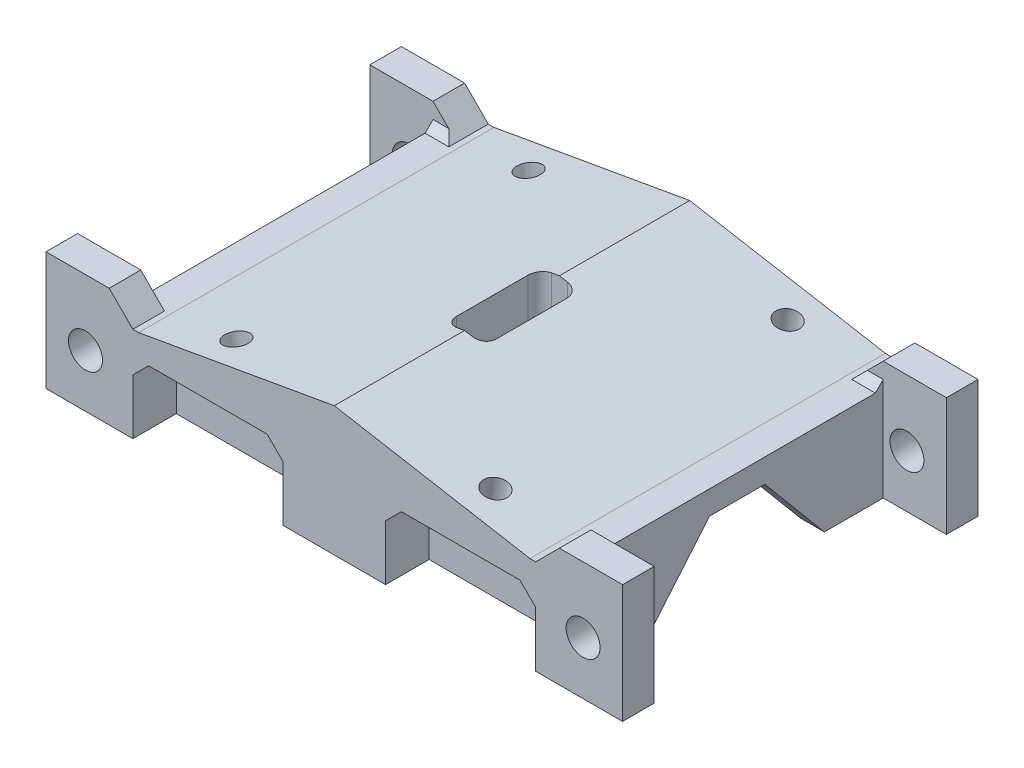
from build123d import *

# Parameters (mm, degrees)
SKETCH_1_W                 = 57
SKETCH_1_H                 = 45
EXTRUDE_1_DEPTH            = 3
SKETCH_2_W                 = 4
SKETCH_2_H                 = 15
EXTRUDE_2_DEPTH            = 8
SKETCH_3_W                 = 4
SKETCH_3_H                 = 15
EXTRUDE_3_DEPTH            = 8
EXTRUDE_4_DEPTH            = 3
EXTRUDE_5_DEPTH            = 3
CHAMFER_1_SIZE             = 3
SKETCH_6_R                 = 2.15
CUT_EXTRUDE_1_DEPTH        = 4
SKETCH_8_W                 = 8
SKETCH_8_H                 = 3
EXTRUDE_6_DEPTH            = 9
EXTRUDE_7_DEPTH            = 3
SKETCH_12_W                = 5
SKETCH_12_H                = 12
CUT_EXTRUDE_4_DEPTH        = 3
FILLET_1_R                 = 1.5
EXTRUDE_9_REACH            = 82.13
SKETCH_15_W                = 45
SKETCH_15_H                = 17.726539555
SKETCH_16_R                = 1.5
CUT_EXTRUDE_5_DEPTH        = 81.129959324
CHAMFER_1_OF_MIRROR_2_SIZE = 3
CHAMFER_2_SIZE             = 1
CHAMFER_3_SIZE             = 2
DELETE_START               = -45
DELETE_FACE_1_DEPTH        = 45
DELETE_FACE_1_2_DEPTH      = 18
DELETE_START_2             = -18
DELETE_FACE_1_3_DEPTH      = 18
DELETE_START_3             = 3
DELETE_FACE_1_4_DEPTH      = 5
SKETCH_20_W                = 22
SKETCH_20_H                = 4
EXTRUDE_2_2_DEPTH          = 10
MIRROR_4_COPY_1_DEPTH      = 3
SKETCH_21_W                = 4
SKETCH_21_H                = 26
EXTRUDE_3_2_DEPTH          = 10
CHAMFER_4_SIZE             = 2


with BuildPart() as part:
    # 草图1 → 凸台-拉伸1 (new body)
    with BuildSketch(Plane(origin=(0, 0, 0), x_dir=(1, 0, 0), z_dir=(0, 1, 0))):
        with Locations((28.5, 22.5)):
            Rectangle(SKETCH_1_W, SKETCH_1_H)
    extrude(amount=EXTRUDE_1_DEPTH)

    # 草图2 → Extrude 2 (add)
    with BuildSketch(Plane.ZY):
        with Locations((-2, -1.5)):
            Rectangle(SKETCH_2_W, SKETCH_2_H)
    extrude_2 = extrude(amount=EXTRUDE_2_DEPTH)

    # 草图3 → Extrude 3 (add)
    with BuildSketch(Plane(origin=(57, 0, 0), x_dir=(0, 0, -1), z_dir=(1, 0, 0))):
        with Locations((2, -1.5)):
            Rectangle(SKETCH_3_W, SKETCH_3_H)
    extrude_3 = extrude(amount=EXTRUDE_3_DEPTH)

    # 草图4 → 凸台-拉伸4 (add)
    with BuildSketch(Plane.ZY.offset(-57)):
        Polygon((-11.448103319, -9), (-19, 0), (0, 0), (0, -9), align=None)
    extrude_4 = extrude(amount=EXTRUDE_4_DEPTH)

    # 草图5 → 凸台-拉伸5 (add)
    with BuildSketch(Plane(origin=(0, 0, 0), x_dir=(0, 0, -1), z_dir=(1, 0, 0))):
        Polygon((19, 0), (0, 0), (0, -9), (11.448103319, -9), align=None)
    extrude_5 = extrude(amount=EXTRUDE_5_DEPTH)

    # 倒角1
    chamfer_1_edges = [part.edges().sort_by_distance(p)[0] for p in [
        (0, 3, -2),
        (57, 3, -2),
    ]]
    chamfer(chamfer_1_edges, length=CHAMFER_1_SIZE - 0.0001)  # a hair under: the kernel refuses the full size

    # 草图6 → 切除-拉伸1 (cut)
    with BuildSketch(Plane(origin=(0, 0, -4), x_dir=(-1, 0, 0), z_dir=(0, 0, -1))):
        with Locations(Location((3, -2.323268139, 0), (0, 0, 90))):
            Circle(SKETCH_6_R)
        with Locations(Location((-60, -2.323268139, 0), (0, 0, 90))):
            Circle(SKETCH_6_R)
    cut_extrude_1 = extrude(amount=-CUT_EXTRUDE_1_DEPTH, mode=Mode.SUBTRACT)

    # 草图8 → 凸台-拉伸6 (add)
    with BuildSketch(Plane.XZ):
        with Locations((28, -43.5)):
            Rectangle(SKETCH_8_W, SKETCH_8_H)
    extrude_6 = extrude(amount=EXTRUDE_6_DEPTH)

    # 草图9 → 凸台-拉伸7 (add)
    with BuildSketch(Plane(origin=(32, 0, 0), x_dir=(0, 0, -1), z_dir=(1, 0, 0))):
        Polygon((45, 0), (29, 0), (35.301867844, -9), (45, -9), align=None)
    extrude_7 = extrude(amount=EXTRUDE_7_DEPTH)

    # 草图12 → 切除-拉伸4 (cut)
    with BuildSketch(Plane(origin=(0, 3, 0), x_dir=(1, 0, 0), z_dir=(0, 1, 0))):
        with Locations((28.5, 22.5)):
            Rectangle(SKETCH_12_W, SKETCH_12_H)
    extrude(amount=-CUT_EXTRUDE_4_DEPTH, mode=Mode.SUBTRACT)

    # 圆角1
    fillet_1_edges = [part.edges().sort_by_distance(p)[0] for p in [
        (26, 1.5, -28.5),
        (31, 1.5, -28.5),
        (31, 1.5, -16.5),
        (26, 1.5, -16.5),
    ]]
    fillet(fillet_1_edges, radius=FILLET_1_R)

    # 草图15 → 凸台-拉伸9 (add, up to next)
    with BuildSketch(Plane(origin=(2.119507574, 12.02032477, 0), x_dir=(0, 0, 1), z_dir=(0.17364817766693066, 0.9848077530122081, 0)), mode=Mode.PRIVATE) as extrude_9_sk1:
        with Locations((-22.5, 43.795404353)):
            Rectangle(SKETCH_15_W, SKETCH_15_H)
    extrude_9_tool1 = extrude(extrude_9_sk1.sketch, amount=-EXTRUDE_9_REACH, mode=Mode.PRIVATE) - part.part
    extrude_9 = extrude_9_tool1.solids().sort_by_distance((45.249561, 4.415333, -22.5))[0]
    add(extrude_9)

    # 草图16 → 切除-拉伸5 (cut, through all)
    with BuildSketch(Plane(origin=(2.119507574, 12.02032477, 0), x_dir=(0.9848077530122081, -0.17364817766693064, 0), z_dir=(0.17364817766693064, 0.9848077530122081, 0))):
        with Locations(Location((43.439057305, 41, 0), (0, 0, 180))):
            Circle(SKETCH_16_R)
        with Locations((43.439057305, 4)):
            Circle(SKETCH_16_R)
    cut_extrude_5 = extrude(amount=-CUT_EXTRUDE_5_DEPTH, mode=Mode.SUBTRACT)

    # 镜向1: 凸台-拉伸9, 切除-拉伸5 across plane
    add(extrude_9.mirror(Plane(origin=(28.5, 0, 0), x_dir=(0, 0, 1), z_dir=(1, 0, 0))))
    add(cut_extrude_5.mirror(Plane(origin=(28.5, 0, 0), x_dir=(0, 0, 1), z_dir=(1, 0, 0))), mode=Mode.SUBTRACT)

    # 镜向2: Extrude 2, Extrude 3, 凸台-拉伸4, 凸台-拉伸5, 切除-拉伸1 across plane
    add(extrude_2.mirror(Plane.XY.offset(-22.5)))
    add(extrude_3.mirror(Plane.XY.offset(-22.5)))
    add(extrude_4.mirror(Plane.XY.offset(-22.5)))
    add(extrude_5.mirror(Plane.XY.offset(-22.5)))
    add(cut_extrude_1.mirror(Plane.XY.offset(-22.5)), mode=Mode.SUBTRACT)

    # 倒角1 of 镜向2
    chamfer_1_of_mirror_2_edges = [part.edges().sort_by_distance(p)[0] for p in [
        (0, 3, -43),
        (57, 3, -43),
    ]]
    chamfer(chamfer_1_of_mirror_2_edges, length=CHAMFER_1_OF_MIRROR_2_SIZE - 0.0001)  # a hair under: the kernel refuses the full size

    # 倒角2
    chamfer_2_edges = [part.edges().sort_by_distance(p)[0] for p in [
        (55.50005, 3, -41),
        (1.49995, 3, -41),
    ]]
    chamfer(chamfer_2_edges, length=CHAMFER_2_SIZE)

    # 倒角3
    chamfer_3_edges = [part.edges().sort_by_distance(p)[0] for p in [
        (35, 0, -37),
        (54, 0, -35.5),
        (3, 0, -35.5),
        (54, 0, -9.5),
        (3, 0, -9.5),
    ]]
    chamfer(chamfer_3_edges, length=CHAMFER_3_SIZE)

    # Delete Face 1: read off the stored shape, not the designer's step
    # Delete Face 1 outline → Delete Face 1 (add)
    with BuildSketch(Plane.XY.offset(DELETE_START)):
        Polygon((26, 6.927914739), (20.479055467, 5.954423259), (21, 3), (26, 3), align=None)
        Polygon((36.520944533, 5.954423259), (31, 6.927914739), (31, 3), (36, 3), align=None)
    extrude(amount=DELETE_FACE_1_DEPTH)

    # Delete Face 1 2 outline → Delete Face 1 2 (add)
    with BuildSketch(Plane.XY.offset(DELETE_START)):
        Polygon((28.5, 7.368732191), (26, 6.927914739), (26, 3), (31, 3), (31, 6.927914739), align=None)
    extrude(amount=DELETE_FACE_1_2_DEPTH)

    # Delete Face 1 3 outline → Delete Face 1 3 (add)
    with BuildSketch(Plane.XY.offset(DELETE_START_2)):
        Polygon((28.5, 7.368732191), (26, 6.927914739), (26, 3), (31, 3), (31, 6.927914739), align=None)
    extrude(amount=DELETE_FACE_1_3_DEPTH)

    # Delete Face 1 4 outline → Delete Face 1 4 (cut)
    with BuildSketch(Plane(origin=(0, 0, 0), x_dir=(1, 0, 0), z_dir=(0, 1, 0)).offset(DELETE_START_3)):
        with BuildLine():
            ThreePointArc((31, 27), (30.560660172, 28.060660172), (29.5, 28.5))
            Line((29.5, 28.5), (27.5, 28.5))
            ThreePointArc((27.5, 28.5), (26.439339828, 28.060660172), (26, 27))
            Line((26, 27), (31, 27))
        make_face()
        with BuildLine():
            ThreePointArc((26, 18), (26.439339828, 16.939339828), (27.5, 16.5))
            Line((27.5, 16.5), (29.5, 16.5))
            ThreePointArc((29.5, 16.5), (30.560660172, 16.939339828), (31, 18))
            Line((31, 18), (26, 18))
        make_face()
    extrude(amount=DELETE_FACE_1_4_DEPTH, mode=Mode.SUBTRACT)

    # 镜向3: 凸台-拉伸7 across plane
    add(extrude_7.mirror(Plane.ZY.offset(-28.5)))

    # 草图20 → Extrude 2 2 (add)
    with BuildSketch(Plane.XZ.offset(9)):
        with Locations((14, -37.5)):
            Rectangle(SKETCH_20_W, SKETCH_20_H)
        with Locations((43, -37.5)):
            Rectangle(SKETCH_20_W, SKETCH_20_H)
    extrude_2_2 = extrude(amount=-EXTRUDE_2_2_DEPTH)

    # 镜向4: 凸台-拉伸6, 凸台-拉伸7, Extrude 2 2 across plane
    add(extrude_6.mirror(Plane.XY.offset(-22.5)))
    add(extrude_7.mirror(Plane.XY.offset(-22.5)))
    add(extrude_2_2.mirror(Plane.XY.offset(-22.5)))

    # 镜向4 copy 1 sketch → 镜向4 copy 1 (add)
    with BuildSketch(Plane(origin=(25, 0, -45), x_dir=(0, 0, 1), z_dir=(-1, 0, 0))):
        Polygon((45, 0), (29, 0), (35.301867844, -9), (45, -9), align=None)
    extrude(amount=MIRROR_4_COPY_1_DEPTH)

    # 草图21 → Extrude 3 2 (add)
    with BuildSketch(Plane.XZ.offset(9)):
        with Locations((13.5, -22.5)):
            Rectangle(SKETCH_21_W, SKETCH_21_H)
    extrude_3_2 = extrude(amount=-EXTRUDE_3_2_DEPTH)

    # 镜向5: Extrude 3 2 across plane
    add(extrude_3_2.mirror(Plane.ZY.offset(-28.5)))

    # 倒角4
    chamfer_4_edges = [part.edges().sort_by_distance(p)[0] for p in [
        (22, 0, -42.25),
        (22, 0, -32.25),
        (22, 0, -2.75),
        (22, 0, -12.75),
        (35, 0, -2.75),
        (35, 0, -12.75),
    ]]
    chamfer(chamfer_4_edges, length=CHAMFER_4_SIZE)


solid = part.part
